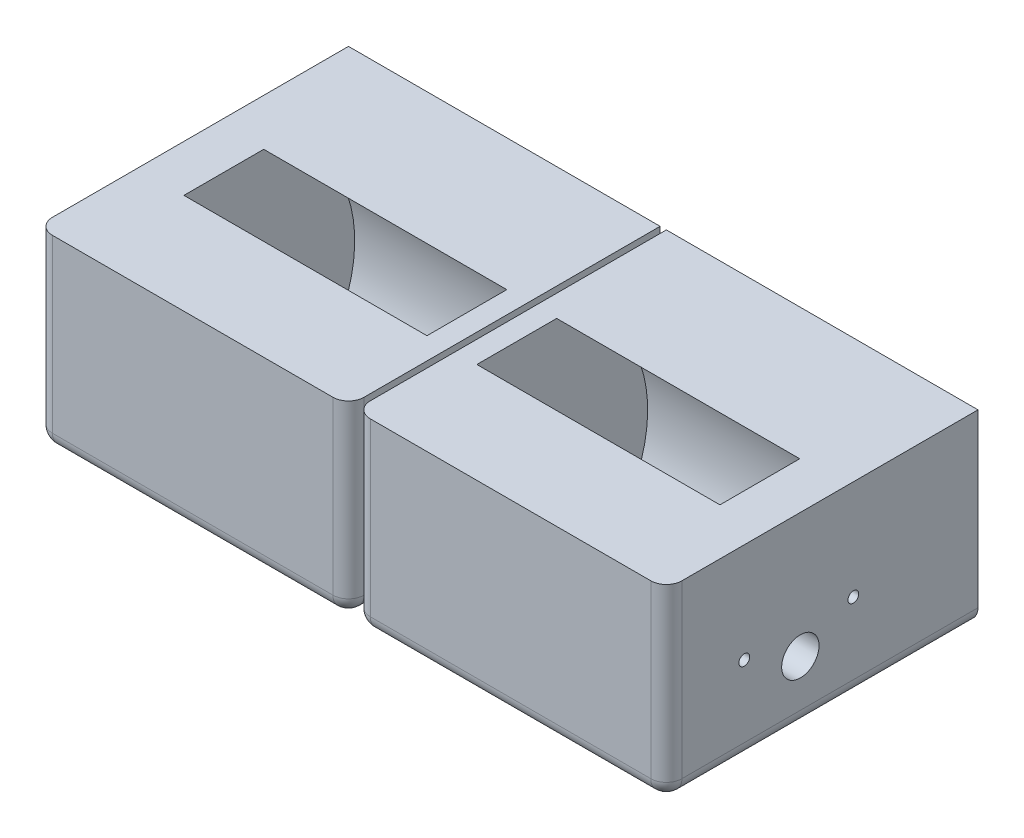
from build123d import *

# Parameters (mm, degrees)
SKETCH1_W                     = 100
SKETCH1_H                     = 60
BOSS_EXTRUDE1_DEPTH           = 100
CUT_EXTRUDE3_START            = -35
CUT_EXTRUDE3_DEPTH            = 78
CUT_EXTRUDE4_START            = -50
CUT_EXTRUDE4_OUTLINE_R        = 2.5
CUT_EXTRUDE4_DEPTH            = 100
CUT_EXTRUDE5_REACH            = 146.568
SKETCH3_R                     = 6
TAP_DRILL_FOR_8_32_TAP1_D     = 3.4544
TAP_DRILL_FOR_8_32_TAP1_DEPTH = 20
TAP_DRILL_FOR_8_32_TAP1_TIP   = 1.037806461
CUT_EXTRUDE6_DEPTH            = 80
CUT_EXTRUDE6_DEPTH_BACK       = 2
SKETCH7_R                     = 6
SKETCH8_W                     = 15
SKETCH8_H                     = 3
CUT_EXTRUDE7_DEPTH            = 5
SKETCH9_W                     = 15
SKETCH9_H                     = 2.533814688
CUT_EXTRUDE8_DEPTH            = 1.5
FILLET1_R                     = 5


# Read off the part's stored shape, not the designer's step: Cut-Extrude3, Cut-Extrude4
with BuildPart() as part:
    # Sketch1 → Boss-Extrude1 (new body)
    with BuildSketch(Plane.XY):
        Rectangle(SKETCH1_W, SKETCH1_H)
    extrude(amount=BOSS_EXTRUDE1_DEPTH)

    # Cut-Extrude3 outline → Cut-Extrude3 (cut)
    with BuildSketch(Plane.YZ.offset(CUT_EXTRUDE3_START)):
        with BuildLine():
            Line((30, 42.193751525), (30, 67.806248475))
            ThreePointArc((30, 67.806248475), (5.668996219, 93.96771173), (-30, 91.932370625))
            Line((-30, 91.932370625), (-30, 18.067629375))
            ThreePointArc((-30, 18.067629375), (5.668996219, 16.03228827), (30, 42.193751525))
        make_face()
    extrude(amount=CUT_EXTRUDE3_DEPTH, mode=Mode.SUBTRACT)

    # Cut-Extrude4 outline → Cut-Extrude4 (cut)
    with BuildSketch(Plane.YZ.offset(CUT_EXTRUDE4_START)):
        with Locations((-10, 57)):
            Circle(CUT_EXTRUDE4_OUTLINE_R)
    extrude(amount=CUT_EXTRUDE4_DEPTH, mode=Mode.SUBTRACT)

    # Sketch3 → Cut-Extrude5 (cut, up to next)
    with BuildSketch(Plane.ZY.offset(50), mode=Mode.PRIVATE) as cut_extrude5_sk1:
        with Locations(Location((57, -10, 0), (0, 0, 270))):
            Circle(SKETCH3_R)
    cut_extrude5_tool1 = extrude(cut_extrude5_sk1.sketch, amount=-CUT_EXTRUDE5_REACH, mode=Mode.PRIVATE) & part.part
    add(cut_extrude5_tool1.solids().sort_by_distance((-50, -10, 57))[0], mode=Mode.SUBTRACT)

    # Tap Drill for #8-32 Tap1
    with Locations(Plane.ZY.offset(50)):
        with Locations((75, -2), (40, -2)):
            Hole(TAP_DRILL_FOR_8_32_TAP1_D / 2, depth=TAP_DRILL_FOR_8_32_TAP1_DEPTH)
            with Locations((0, 0, -(TAP_DRILL_FOR_8_32_TAP1_DEPTH + TAP_DRILL_FOR_8_32_TAP1_TIP / 2))):  # 118° drill point
                Cone(0, TAP_DRILL_FOR_8_32_TAP1_D / 2, TAP_DRILL_FOR_8_32_TAP1_TIP, mode=Mode.SUBTRACT)

    # Sketch7 → Cut-Extrude6 (cut, two sides: drawn at the far end of the back side and taken through both)
    with BuildSketch(Plane.ZY.offset(-43).offset(-CUT_EXTRUDE6_DEPTH_BACK)):
        with Locations(Location((57, -10, 0), (0, 0, 270))):
            Circle(SKETCH7_R)
    extrude(amount=CUT_EXTRUDE6_DEPTH + CUT_EXTRUDE6_DEPTH_BACK, mode=Mode.SUBTRACT)

    # Sketch8 → Cut-Extrude7 (cut)
    with BuildSketch(Plane.XZ.offset(30)):
        with Locations((4, 95.966185313)):
            Rectangle(SKETCH8_W, SKETCH8_H)
    extrude(amount=-CUT_EXTRUDE7_DEPTH, mode=Mode.SUBTRACT)

    # Sketch9 → Cut-Extrude8 (cut)
    with BuildSketch(Plane(origin=(0, -30, 0), x_dir=(-1, 0, 0), z_dir=(0, -1, 0))):
        with Locations((-4, -93.199277969)):
            Rectangle(SKETCH9_W, SKETCH9_H)
    extrude(amount=-CUT_EXTRUDE8_DEPTH, mode=Mode.SUBTRACT)

    # Fillet1
    # the kernel refuses this fillet: 5 mm, written as the material it takes off along each edge
    with BuildSketch(Plane(origin=(-45, -25, 95), x_dir=(0, 0, 1), z_dir=(0, -1, 0))) as fillet1_piece_1_section:
        Polygon((0, 0), (FILLET1_R, 0), (FILLET1_R, FILLET1_R), (0, FILLET1_R), align=None)
    fillet1_piece_1 = extrude(amount=FILLET1_R, mode=Mode.PRIVATE)
    fillet1_piece_1 = fillet1_piece_1 - Plane(origin=(-45, -25, 95), x_dir=(0.7071067811865475, 0, -0.7071067811865475), z_dir=(0, -1, 0)) * Sphere(FILLET1_R, mode=Mode.PRIVATE)
    add(fillet1_piece_1, mode=Mode.SUBTRACT)
    with BuildSketch(Plane(origin=(45, -25, 95), x_dir=(1, 0, 0), z_dir=(0, -1, 0))) as fillet1_piece_2_section:
        Polygon((0, 0), (FILLET1_R, 0), (FILLET1_R, FILLET1_R), (0, FILLET1_R), align=None)
    fillet1_piece_2 = extrude(amount=FILLET1_R, mode=Mode.PRIVATE)
    fillet1_piece_2 = fillet1_piece_2 - Plane(origin=(45, -25, 95), x_dir=(-0.7071067811865475, 0, -0.7071067811865475), z_dir=(0, -1, 0)) * Sphere(FILLET1_R, mode=Mode.PRIVATE)
    add(fillet1_piece_2, mode=Mode.SUBTRACT)
    with BuildSketch(Plane(origin=(-45, -30, 100), x_dir=(0, 0, -1), z_dir=(1, 0, 0))) as fillet1_piece_3:
        with BuildLine():
            CenterArc((FILLET1_R, FILLET1_R), FILLET1_R, 180, 90)
            Line((0, FILLET1_R), (0, 0))
            Line((0, 0), (FILLET1_R, 0))
        make_face()
    extrude(amount=90, mode=Mode.SUBTRACT)
    with BuildSketch(Plane(origin=(50, -30, -12.5), x_dir=(-1, 0, 0), z_dir=(0, 0, 1))) as fillet1_piece_4:
        with BuildLine():
            CenterArc((FILLET1_R, -FILLET1_R), FILLET1_R, 90, 90)
            Line((0, -FILLET1_R), (0, 0))
            Line((0, 0), (FILLET1_R, 0))
        make_face()
    extrude(amount=107.5, mode=Mode.SUBTRACT)
    with BuildSketch(Plane(origin=(-50, -30, -12.5), x_dir=(1, 0, 0), z_dir=(0, 0, 1))) as fillet1_piece_5:
        with BuildLine():
            CenterArc((FILLET1_R, FILLET1_R), FILLET1_R, 180, 90)
            Line((0, FILLET1_R), (0, 0))
            Line((0, 0), (FILLET1_R, 0))
        make_face()
    extrude(amount=107.5, mode=Mode.SUBTRACT)
    with BuildSketch(Plane(origin=(50, -25, 100), x_dir=(0, 0, -1), z_dir=(0, 1, 0))) as fillet1_piece_6:
        with BuildLine():
            CenterArc((FILLET1_R, FILLET1_R), FILLET1_R, 180, 90)
            Line((0, FILLET1_R), (0, 0))
            Line((0, 0), (FILLET1_R, 0))
        make_face()
    extrude(amount=67.5, mode=Mode.SUBTRACT)
    with BuildSketch(Plane(origin=(-50, 42.5, 100), x_dir=(1, 0, 0), z_dir=(0, -1, 0))) as fillet1_piece_7:
        with BuildLine():
            CenterArc((FILLET1_R, -FILLET1_R), FILLET1_R, 90, 90)
            Line((0, -FILLET1_R), (0, 0))
            Line((0, 0), (FILLET1_R, 0))
        make_face()
    extrude(amount=67.5, mode=Mode.SUBTRACT)


with BuildPart() as body_2:
    # Mirror5: mirrored copy
    add(part.part.mirror(Plane(origin=(51, 0, 0), x_dir=(0, 0, 1), z_dir=(1, 0, 0))))


solid = Compound([part.part, body_2.part])
